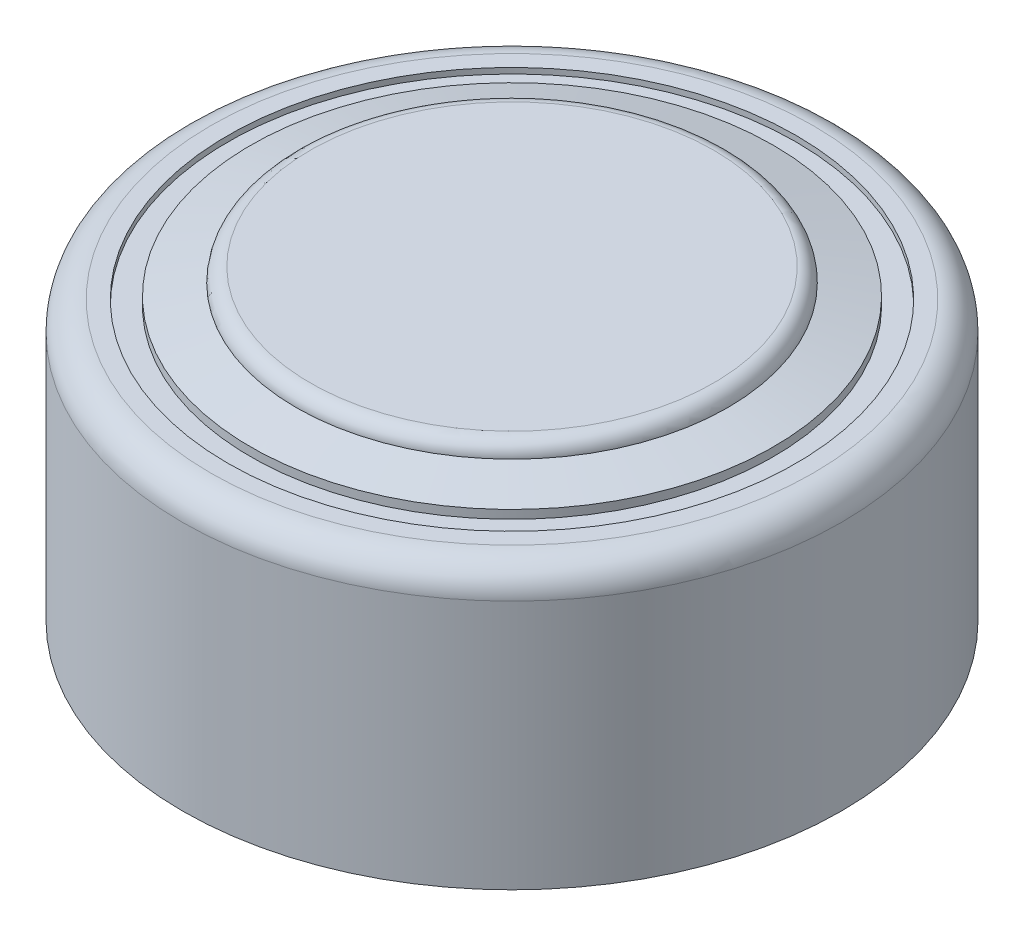
from build123d import *

# Parameters (mm, degrees)
CROQUIS1_R              = 5.8
SALIENTE_EXTRUIR1_DEPTH = 4.9
REDONDEO1_R             = 0.5
CROQUIS2_R              = 5
CORTAR_EXTRUIR1_DEPTH   = 0.1
CROQUIS3_R              = 4.6
SALIENTE_EXTRUIR2_DEPTH = 5.15
CROQUIS4_R              = 3.8
SALIENTE_EXTRUIR3_DEPTH = 5.4
REDONDEO7_R             = 0.25
CHAFL_N1_SIZE           = 0.8
CHAFL_N1_SIZE_2         = 0.2


# Some blends are built 0.0001 mm under size
with BuildPart() as part:
    # Croquis1 → Saliente-Extruir1 (new body)
    with BuildSketch(Plane(origin=(0, 0, 0), x_dir=(1, 0, 0), z_dir=(0, 1, 0))):
        with Locations(Location((0, 0, 0), (0, 0, 270))):
            Circle(CROQUIS1_R)
    extrude(amount=SALIENTE_EXTRUIR1_DEPTH)

    # Redondeo1
    redondeo1_edges = [part.edges().sort_by_distance(p)[0] for p in [
        (0, 4.9, -5.8),
    ]]
    fillet(redondeo1_edges, radius=REDONDEO1_R)

    # Croquis2 → Cortar-Extruir1 (cut)
    with BuildSketch(Plane(origin=(0, 4.9, 0), x_dir=(1, 0, 0), z_dir=(0, 1, 0))):
        with Locations(Location((0, 0, 0), (0, 0, 270))):
            Circle(CROQUIS2_R)
    extrude(amount=-CORTAR_EXTRUIR1_DEPTH, mode=Mode.SUBTRACT)

    # Croquis3 → Saliente-Extruir2 (add)
    with BuildSketch(Plane.XZ):
        with Locations(Location((0, 0, 0), (0, 0, 270))):
            Circle(CROQUIS3_R)
    extrude(amount=-SALIENTE_EXTRUIR2_DEPTH)

    # Croquis4 → Saliente-Extruir3 (add)
    with BuildSketch(Plane.XZ):
        with Locations(Location((0, 0, 0), (0, 0, 270))):
            Circle(CROQUIS4_R)
    extrude(amount=-SALIENTE_EXTRUIR3_DEPTH)

    # Redondeo7
    redondeo7_edges = [part.edges().sort_by_distance(p)[0] for p in [
        (0, 5.4, 3.8),
    ]]
    fillet(redondeo7_edges, radius=REDONDEO7_R - 0.0001)  # a hair under: the kernel refuses the full size

    # Chaflán1
    # the kernel refuses this chamfer: 0.8, 0.2 mm, written as the material it takes off along each edge
    with BuildSketch(Plane(origin=(0, 5.15, 0), x_dir=(0, 0, -1), z_dir=(-1, 0, 0))) as chafl_n1_piece_1_section:
        Polygon((4.6 - CHAFL_N1_SIZE, 0), (4.6, CHAFL_N1_SIZE_2), (4.6, 0), align=None)
    chafl_n1_piece_1 = revolve(axis=Axis((0, 5.15, 0), (0, -1, 0)), mode=Mode.PRIVATE)
    chafl_n1_piece_1 = chafl_n1_piece_1 - Plane(origin=(0, 5.059567154, 0), x_dir=(0, 0, -1), z_dir=(0, -1, 0)) * Cylinder(3.8, 19, mode=Mode.PRIVATE)
    add(chafl_n1_piece_1, mode=Mode.SUBTRACT)


solid = part.part
